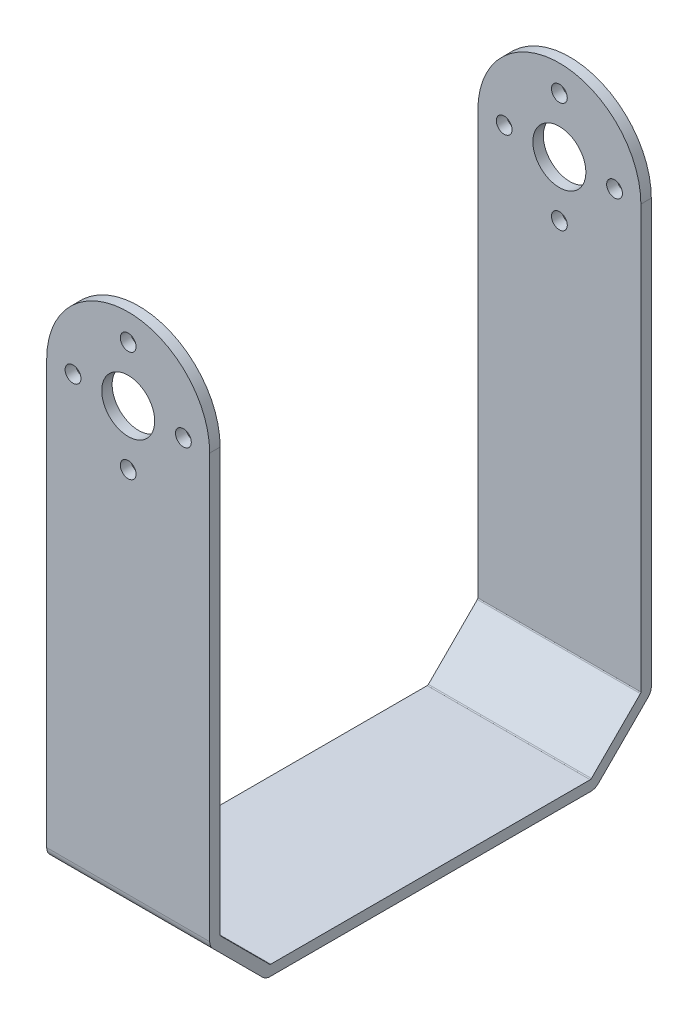
from build123d import *

# Parameters (mm, degrees)
SKETCH2_W         = 66.675
SKETCH2_H         = 85.3186
EXTRUDE1_DEPTH    = 24.6126
SKETCH3_OUTSIDE_W = 90.883
SKETCH3_OUTSIDE_H = 109.527
EXTRUDE2_DEPTH    = 24.6126
SKETCH4_OUTSIDE_W = 48.821
SKETCH4_OUTSIDE_H = 109.527
EXTRUDE3_DEPTH    = 112.043231265
FILLET1_R         = 1.5875
FILLET2_R         = 0.254
SKETCH5_R         = 4.0005
SKETCH5_R_2       = 1.1938
EXTRUDE4_DEPTH    = 112.043231265


with BuildPart() as part:
    # Sketch2 → Extrude1 (new body)
    with BuildSketch(Plane(origin=(0, 0, 0), x_dir=(0, 0, -1), z_dir=(1, 0, 0))):
        with Locations((33.3375, 42.6593)):
            Rectangle(SKETCH2_W, SKETCH2_H)
    extrude(amount=EXTRUDE1_DEPTH)

    # Sketch3 outside → Extrude2 (cut)
    with BuildSketch(Plane(origin=(24.6126, 0, 0), x_dir=(0, 0, -1), z_dir=(1, 0, 0))):
        with Locations((33.3375, 42.6595)):
            Rectangle(SKETCH3_OUTSIDE_W, SKETCH3_OUTSIDE_H)
        Polygon((1.5748, 85.3186), (1.5748, 9.1186), (9.1186, 1.5748), (57.5564, 1.5748), (65.1002, 9.1186), (65.1002, 85.3186), (66.675, 85.3186), (66.675, 8.466296482), (58.208703518, 0), (8.466296482, 0), (0, 8.466296482), (0, 85.3186), align=None, mode=Mode.SUBTRACT)
    extrude(amount=-EXTRUDE2_DEPTH, mode=Mode.SUBTRACT)

    # Sketch4 outside → Extrude3 (cut, through all)
    with BuildSketch(Plane.XY):
        with Locations((12.3065, 42.6595)):
            Rectangle(SKETCH4_OUTSIDE_W, SKETCH4_OUTSIDE_H)
        with BuildLine():
            Line((0, 73.0123), (0, 0))
            Line((0, 0), (24.6126, 0))
            Line((24.6126, 0), (24.6126, 73.0123))
            ThreePointArc((24.6126, 73.0123), (12.3063, 85.3186), (0, 73.0123))
        make_face(mode=Mode.SUBTRACT)
    extrude(amount=-EXTRUDE3_DEPTH, mode=Mode.SUBTRACT)

    # Fillet1
    fillet1_edges = [part.edges().sort_by_distance(p)[0] for p in [
        (12.3063, 0, -58.208703518),
        (12.3063, 8.466296482, -66.675),
        (12.3063, 0, -8.466296482),
        (12.3063, 8.466296482, 0),
    ]]
    fillet(fillet1_edges, radius=FILLET1_R)

    # Fillet2
    fillet2_edges = [part.edges().sort_by_distance(p)[0] for p in [
        (12.3063, 9.1186, -65.1002),
        (12.3063, 1.5748, -57.5564),
        (12.3063, 1.5748, -9.1186),
        (12.3063, 9.1186, -1.5748),
    ]]
    fillet(fillet2_edges, radius=FILLET2_R)

    # Sketch5 → Extrude4 (cut, through all)
    with BuildSketch(Plane.XY):
        with Locations((12.3063, 73.025)):
            Circle(SKETCH5_R)
        with Locations((12.3063, 81.3562)):
            Circle(SKETCH5_R_2)
        with Locations((3.9751, 73.025)):
            Circle(SKETCH5_R_2)
        with Locations((12.3063, 64.6938)):
            Circle(SKETCH5_R_2)
        with Locations((20.6375, 73.025)):
            Circle(SKETCH5_R_2)
    extrude(amount=-EXTRUDE4_DEPTH, mode=Mode.SUBTRACT)


solid = part.part
